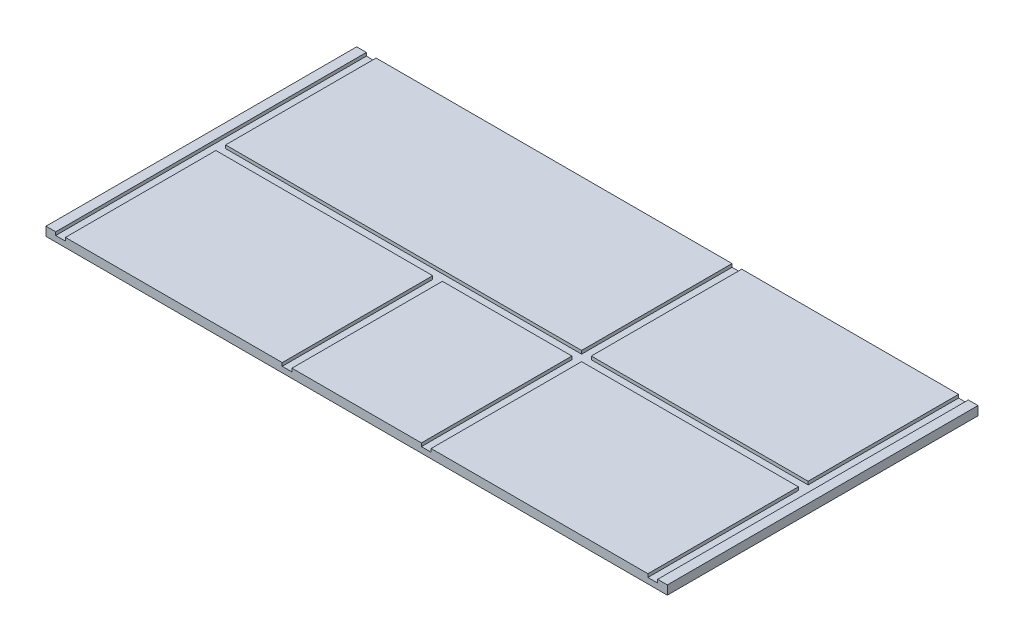
from build123d import *

# Parameters (mm, degrees)
SKETCH1_W           = 1219.2
SKETCH1_H           = 609.6
BOSS_EXTRUDE1_DEPTH = 17.4752
CUT_EXTRUDE1_DEPTH  = 6.35


with BuildPart() as part:
    # Sketch1 → Boss-Extrude1 (new body)
    with BuildSketch(Plane(origin=(0, 0, 0), x_dir=(1, 0, 0), z_dir=(0, 1, 0))):
        Rectangle(SKETCH1_W, SKETCH1_H)
    extrude(amount=BOSS_EXTRUDE1_DEPTH)

    # Sketch2 → Cut-Extrude1 (cut)
    with BuildSketch(Plane(origin=(0, 17.4752, 0), x_dir=(1, 0, 0), z_dir=(0, 1, 0))):
        Polygon((-590.55, 304.8), (-571.5, 304.8), (-571.5, 9.525), (127, 9.525), (127, 304.8), (146.05, 304.8), (146.05, 9.525), (571.5, 9.525), (571.5, 304.8), (590.55, 304.8), (590.55, -304.8), (571.5, -304.8), (571.5, -9.525), (146.05, -9.525), (146.05, -304.8), (127, -304.8), (127, -9.525), (-127, -9.525), (-127, -304.8), (-146.05, -304.8), (-146.05, -9.525), (-571.5, -9.525), (-571.5, -304.8), (-590.55, -304.8), align=None)
    extrude(amount=-CUT_EXTRUDE1_DEPTH, mode=Mode.SUBTRACT)


solid = part.part
